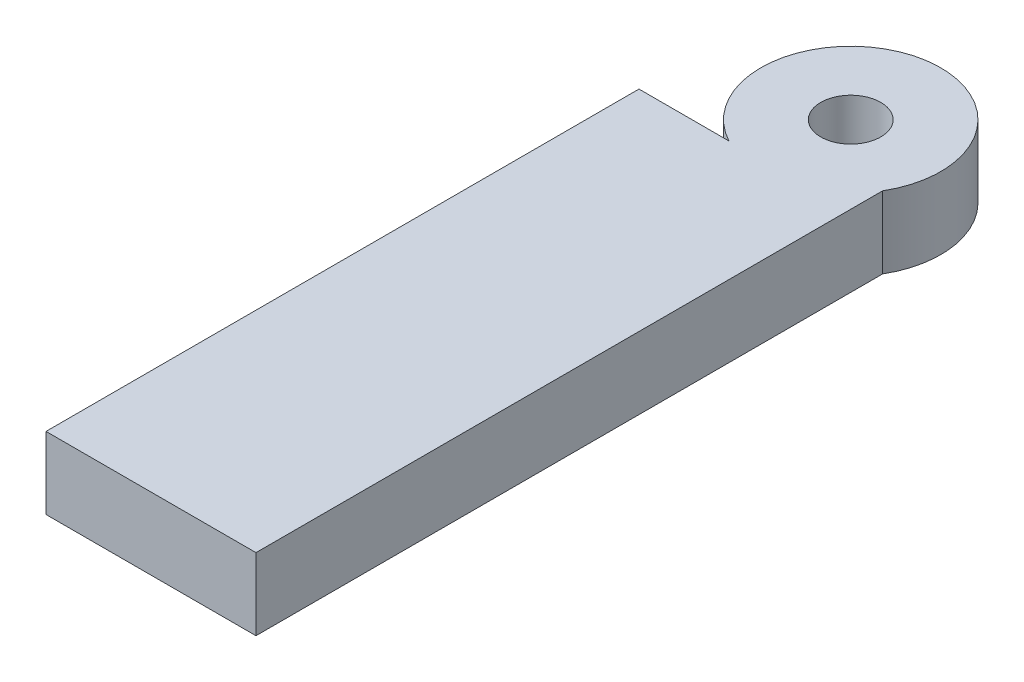
from build123d import *

# Parameters (mm, degrees)
SKETCH1_R           = 3.175
BOSS_EXTRUDE1_DEPTH = 7.62
SKETCH2_R           = 2.54
CUT_EXTRUDE1_DEPTH  = 6.35
BOSS_EXTRUDE2_START = 9.525
SKETCH3_W           = 62.764867648
SKETCH3_H           = 7.62
SKETCH3_R           = 2.54
BOSS_EXTRUDE2_DEPTH = 9.525


with BuildPart() as part:
    # Sketch1 → Boss-Extrude1 (new body)
    with BuildSketch(Plane(origin=(0, 0, 0), x_dir=(1, 0, 0), z_dir=(0, 1, 0))):
        with BuildLine():
            Line((-4.490128061, -8.400260413), (-4.490128061, -71.165128061))
            Line((-4.490128061, -71.165128061), (8.209871939, -71.165128061))
            Line((8.209871939, -71.165128061), (8.209871939, -4.829454186))
            ThreePointArc((8.209871939, -4.829454186), (-2.578136518, 9.169451297), (-4.490128061, -8.400260413))
        make_face()
        Circle(SKETCH1_R, mode=Mode.SUBTRACT)
    extrude(amount=BOSS_EXTRUDE1_DEPTH)

    # Sketch2 → Cut-Extrude1 (cut)
    with BuildSketch(Plane.ZY.offset(4.490128061)):
        with Locations((14.750260413, 3.81)):
            Circle(SKETCH2_R)
        with Locations((52.850260413, 3.81)):
            Circle(SKETCH2_R)
    extrude(amount=-CUT_EXTRUDE1_DEPTH, mode=Mode.SUBTRACT)

    # Sketch3 → Boss-Extrude2 (add)
    with BuildSketch(Plane.ZY.offset(4.490128061).offset(BOSS_EXTRUDE2_START)):
        with Locations((39.782694237, 3.81)):
            Rectangle(SKETCH3_W, SKETCH3_H)
        with Locations((52.850260413, 3.81)):
            Circle(SKETCH3_R, mode=Mode.SUBTRACT)
        with Locations((14.750260413, 3.81)):
            Circle(SKETCH3_R, mode=Mode.SUBTRACT)
    extrude(amount=-BOSS_EXTRUDE2_DEPTH)


solid = part.part
